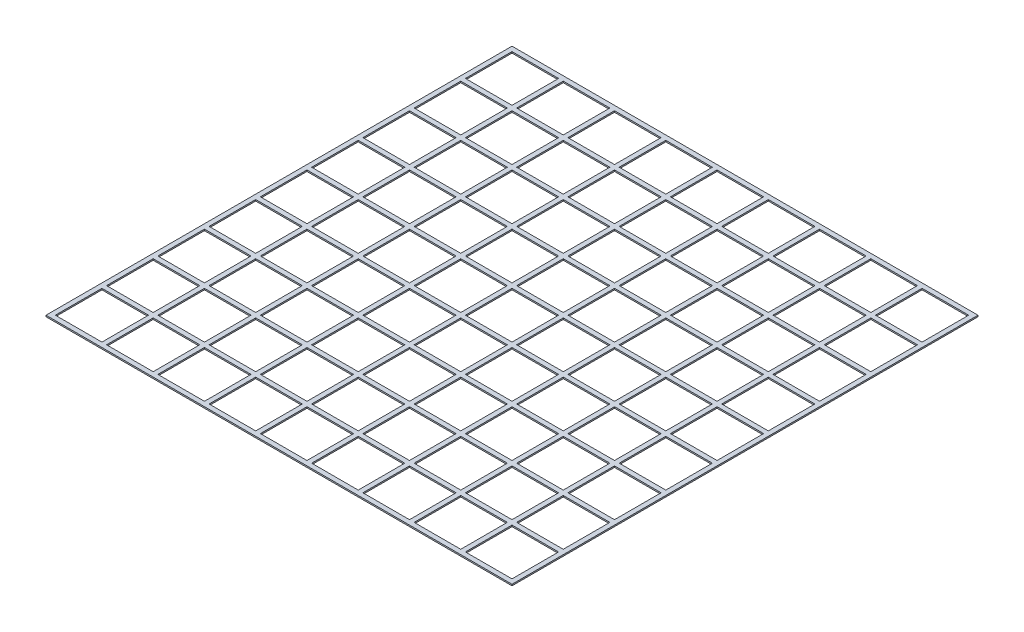
from build123d import *

# Parameters (mm, degrees)
SKETCH1_W                 = 1000
SKETCH1_H                 = 1000
BASE_FLANGE1_DEPTH        = 3
FILL_START                = -490
FILL_PATTERN1_OUTLINE_W   = 3
FILL_PATTERN1_OUTLINE_H   = 100
FILL_PATTERN1_DEPTH       = 100
FILL_START_2              = -380
FILL_PATTERN1_2_OUTLINE_W = 3
FILL_PATTERN1_2_OUTLINE_H = 100
FILL_PATTERN1_2_DEPTH     = 100
FILL_START_3              = -270
FILL_PATTERN1_3_OUTLINE_W = 3
FILL_PATTERN1_3_OUTLINE_H = 100
FILL_PATTERN1_3_DEPTH     = 100
FILL_START_4              = -160
FILL_PATTERN1_4_OUTLINE_W = 3
FILL_PATTERN1_4_OUTLINE_H = 100
FILL_PATTERN1_4_DEPTH     = 100
FILL_START_5              = -50
FILL_PATTERN1_5_OUTLINE_W = 3
FILL_PATTERN1_5_OUTLINE_H = 100
FILL_PATTERN1_5_DEPTH     = 100
FILL_START_6              = 60
FILL_PATTERN1_6_OUTLINE_W = 3
FILL_PATTERN1_6_OUTLINE_H = 100
FILL_PATTERN1_6_DEPTH     = 100
FILL_START_7              = 170
FILL_PATTERN1_7_OUTLINE_W = 3
FILL_PATTERN1_7_OUTLINE_H = 100
FILL_PATTERN1_7_DEPTH     = 100
FILL_START_8              = 280
FILL_PATTERN1_8_OUTLINE_W = 3
FILL_PATTERN1_8_OUTLINE_H = 100
FILL_PATTERN1_8_DEPTH     = 100
FILL_START_9              = 390
FILL_PATTERN1_9_OUTLINE_W = 3
FILL_PATTERN1_9_OUTLINE_H = 100
FILL_PATTERN1_9_DEPTH     = 100


# Read off the part's stored shape, not the designer's step: Fill Pattern1
# Sheet-metal steps are written as plain solids
with BuildPart() as part:
    # Sketch1 → Base-Flange1 (new body)
    with BuildSketch(Plane(origin=(0, 0, 0), x_dir=(1, 0, 0), z_dir=(0, 1, 0))):
        Rectangle(SKETCH1_W, SKETCH1_H)
    extrude(amount=-BASE_FLANGE1_DEPTH)

    # Fill Pattern1 outline → Fill Pattern1 (cut)
    with BuildSketch(Plane.YZ.offset(FILL_START)):
        with Locations((-1.5, 0)):
            Rectangle(FILL_PATTERN1_OUTLINE_W, FILL_PATTERN1_OUTLINE_H)
        with Locations((-1.5, -110)):
            Rectangle(FILL_PATTERN1_OUTLINE_W, FILL_PATTERN1_OUTLINE_H)
        with Locations((-1.5, 110)):
            Rectangle(FILL_PATTERN1_OUTLINE_W, FILL_PATTERN1_OUTLINE_H)
        with Locations((-1.5, -220)):
            Rectangle(FILL_PATTERN1_OUTLINE_W, FILL_PATTERN1_OUTLINE_H)
        with Locations((-1.5, 220)):
            Rectangle(FILL_PATTERN1_OUTLINE_W, FILL_PATTERN1_OUTLINE_H)
        with Locations((-1.5, -330)):
            Rectangle(FILL_PATTERN1_OUTLINE_W, FILL_PATTERN1_OUTLINE_H)
        with Locations((-1.5, 330)):
            Rectangle(FILL_PATTERN1_OUTLINE_W, FILL_PATTERN1_OUTLINE_H)
        with Locations((-1.5, -440)):
            Rectangle(FILL_PATTERN1_OUTLINE_W, FILL_PATTERN1_OUTLINE_H)
        with Locations((-1.5, 440)):
            Rectangle(FILL_PATTERN1_OUTLINE_W, FILL_PATTERN1_OUTLINE_H)
    extrude(amount=FILL_PATTERN1_DEPTH, mode=Mode.SUBTRACT)

    # Fill Pattern1 2 outline → Fill Pattern1 2 (cut)
    with BuildSketch(Plane.YZ.offset(FILL_START_2)):
        with Locations((-1.5, 0)):
            Rectangle(FILL_PATTERN1_2_OUTLINE_W, FILL_PATTERN1_2_OUTLINE_H)
        with Locations((-1.5, -110)):
            Rectangle(FILL_PATTERN1_2_OUTLINE_W, FILL_PATTERN1_2_OUTLINE_H)
        with Locations((-1.5, 110)):
            Rectangle(FILL_PATTERN1_2_OUTLINE_W, FILL_PATTERN1_2_OUTLINE_H)
        with Locations((-1.5, -220)):
            Rectangle(FILL_PATTERN1_2_OUTLINE_W, FILL_PATTERN1_2_OUTLINE_H)
        with Locations((-1.5, 220)):
            Rectangle(FILL_PATTERN1_2_OUTLINE_W, FILL_PATTERN1_2_OUTLINE_H)
        with Locations((-1.5, -330)):
            Rectangle(FILL_PATTERN1_2_OUTLINE_W, FILL_PATTERN1_2_OUTLINE_H)
        with Locations((-1.5, 330)):
            Rectangle(FILL_PATTERN1_2_OUTLINE_W, FILL_PATTERN1_2_OUTLINE_H)
        with Locations((-1.5, -440)):
            Rectangle(FILL_PATTERN1_2_OUTLINE_W, FILL_PATTERN1_2_OUTLINE_H)
        with Locations((-1.5, 440)):
            Rectangle(FILL_PATTERN1_2_OUTLINE_W, FILL_PATTERN1_2_OUTLINE_H)
    extrude(amount=FILL_PATTERN1_2_DEPTH, mode=Mode.SUBTRACT)

    # Fill Pattern1 3 outline → Fill Pattern1 3 (cut)
    with BuildSketch(Plane.YZ.offset(FILL_START_3)):
        with Locations((-1.5, 0)):
            Rectangle(FILL_PATTERN1_3_OUTLINE_W, FILL_PATTERN1_3_OUTLINE_H)
        with Locations((-1.5, -110)):
            Rectangle(FILL_PATTERN1_3_OUTLINE_W, FILL_PATTERN1_3_OUTLINE_H)
        with Locations((-1.5, 110)):
            Rectangle(FILL_PATTERN1_3_OUTLINE_W, FILL_PATTERN1_3_OUTLINE_H)
        with Locations((-1.5, -220)):
            Rectangle(FILL_PATTERN1_3_OUTLINE_W, FILL_PATTERN1_3_OUTLINE_H)
        with Locations((-1.5, 220)):
            Rectangle(FILL_PATTERN1_3_OUTLINE_W, FILL_PATTERN1_3_OUTLINE_H)
        with Locations((-1.5, -330)):
            Rectangle(FILL_PATTERN1_3_OUTLINE_W, FILL_PATTERN1_3_OUTLINE_H)
        with Locations((-1.5, 330)):
            Rectangle(FILL_PATTERN1_3_OUTLINE_W, FILL_PATTERN1_3_OUTLINE_H)
        with Locations((-1.5, -440)):
            Rectangle(FILL_PATTERN1_3_OUTLINE_W, FILL_PATTERN1_3_OUTLINE_H)
        with Locations((-1.5, 440)):
            Rectangle(FILL_PATTERN1_3_OUTLINE_W, FILL_PATTERN1_3_OUTLINE_H)
    extrude(amount=FILL_PATTERN1_3_DEPTH, mode=Mode.SUBTRACT)

    # Fill Pattern1 4 outline → Fill Pattern1 4 (cut)
    with BuildSketch(Plane.YZ.offset(FILL_START_4)):
        with Locations((-1.5, 0)):
            Rectangle(FILL_PATTERN1_4_OUTLINE_W, FILL_PATTERN1_4_OUTLINE_H)
        with Locations((-1.5, -110)):
            Rectangle(FILL_PATTERN1_4_OUTLINE_W, FILL_PATTERN1_4_OUTLINE_H)
        with Locations((-1.5, 110)):
            Rectangle(FILL_PATTERN1_4_OUTLINE_W, FILL_PATTERN1_4_OUTLINE_H)
        with Locations((-1.5, -220)):
            Rectangle(FILL_PATTERN1_4_OUTLINE_W, FILL_PATTERN1_4_OUTLINE_H)
        with Locations((-1.5, 220)):
            Rectangle(FILL_PATTERN1_4_OUTLINE_W, FILL_PATTERN1_4_OUTLINE_H)
        with Locations((-1.5, -330)):
            Rectangle(FILL_PATTERN1_4_OUTLINE_W, FILL_PATTERN1_4_OUTLINE_H)
        with Locations((-1.5, 330)):
            Rectangle(FILL_PATTERN1_4_OUTLINE_W, FILL_PATTERN1_4_OUTLINE_H)
        with Locations((-1.5, -440)):
            Rectangle(FILL_PATTERN1_4_OUTLINE_W, FILL_PATTERN1_4_OUTLINE_H)
        with Locations((-1.5, 440)):
            Rectangle(FILL_PATTERN1_4_OUTLINE_W, FILL_PATTERN1_4_OUTLINE_H)
    extrude(amount=FILL_PATTERN1_4_DEPTH, mode=Mode.SUBTRACT)

    # Fill Pattern1 5 outline → Fill Pattern1 5 (cut)
    with BuildSketch(Plane.YZ.offset(FILL_START_5)):
        with Locations((-1.5, 0)):
            Rectangle(FILL_PATTERN1_5_OUTLINE_W, FILL_PATTERN1_5_OUTLINE_H)
        with Locations((-1.5, -110)):
            Rectangle(FILL_PATTERN1_5_OUTLINE_W, FILL_PATTERN1_5_OUTLINE_H)
        with Locations((-1.5, 110)):
            Rectangle(FILL_PATTERN1_5_OUTLINE_W, FILL_PATTERN1_5_OUTLINE_H)
        with Locations((-1.5, -220)):
            Rectangle(FILL_PATTERN1_5_OUTLINE_W, FILL_PATTERN1_5_OUTLINE_H)
        with Locations((-1.5, 220)):
            Rectangle(FILL_PATTERN1_5_OUTLINE_W, FILL_PATTERN1_5_OUTLINE_H)
        with Locations((-1.5, -330)):
            Rectangle(FILL_PATTERN1_5_OUTLINE_W, FILL_PATTERN1_5_OUTLINE_H)
        with Locations((-1.5, 330)):
            Rectangle(FILL_PATTERN1_5_OUTLINE_W, FILL_PATTERN1_5_OUTLINE_H)
        with Locations((-1.5, -440)):
            Rectangle(FILL_PATTERN1_5_OUTLINE_W, FILL_PATTERN1_5_OUTLINE_H)
        with Locations((-1.5, 440)):
            Rectangle(FILL_PATTERN1_5_OUTLINE_W, FILL_PATTERN1_5_OUTLINE_H)
    extrude(amount=FILL_PATTERN1_5_DEPTH, mode=Mode.SUBTRACT)

    # Fill Pattern1 6 outline → Fill Pattern1 6 (cut)
    with BuildSketch(Plane.YZ.offset(FILL_START_6)):
        with Locations((-1.5, 0)):
            Rectangle(FILL_PATTERN1_6_OUTLINE_W, FILL_PATTERN1_6_OUTLINE_H)
        with Locations((-1.5, -110)):
            Rectangle(FILL_PATTERN1_6_OUTLINE_W, FILL_PATTERN1_6_OUTLINE_H)
        with Locations((-1.5, 110)):
            Rectangle(FILL_PATTERN1_6_OUTLINE_W, FILL_PATTERN1_6_OUTLINE_H)
        with Locations((-1.5, -220)):
            Rectangle(FILL_PATTERN1_6_OUTLINE_W, FILL_PATTERN1_6_OUTLINE_H)
        with Locations((-1.5, 220)):
            Rectangle(FILL_PATTERN1_6_OUTLINE_W, FILL_PATTERN1_6_OUTLINE_H)
        with Locations((-1.5, -330)):
            Rectangle(FILL_PATTERN1_6_OUTLINE_W, FILL_PATTERN1_6_OUTLINE_H)
        with Locations((-1.5, 330)):
            Rectangle(FILL_PATTERN1_6_OUTLINE_W, FILL_PATTERN1_6_OUTLINE_H)
        with Locations((-1.5, -440)):
            Rectangle(FILL_PATTERN1_6_OUTLINE_W, FILL_PATTERN1_6_OUTLINE_H)
        with Locations((-1.5, 440)):
            Rectangle(FILL_PATTERN1_6_OUTLINE_W, FILL_PATTERN1_6_OUTLINE_H)
    extrude(amount=FILL_PATTERN1_6_DEPTH, mode=Mode.SUBTRACT)

    # Fill Pattern1 7 outline → Fill Pattern1 7 (cut)
    with BuildSketch(Plane.YZ.offset(FILL_START_7)):
        with Locations((-1.5, 0)):
            Rectangle(FILL_PATTERN1_7_OUTLINE_W, FILL_PATTERN1_7_OUTLINE_H)
        with Locations((-1.5, -110)):
            Rectangle(FILL_PATTERN1_7_OUTLINE_W, FILL_PATTERN1_7_OUTLINE_H)
        with Locations((-1.5, 110)):
            Rectangle(FILL_PATTERN1_7_OUTLINE_W, FILL_PATTERN1_7_OUTLINE_H)
        with Locations((-1.5, -220)):
            Rectangle(FILL_PATTERN1_7_OUTLINE_W, FILL_PATTERN1_7_OUTLINE_H)
        with Locations((-1.5, 220)):
            Rectangle(FILL_PATTERN1_7_OUTLINE_W, FILL_PATTERN1_7_OUTLINE_H)
        with Locations((-1.5, -330)):
            Rectangle(FILL_PATTERN1_7_OUTLINE_W, FILL_PATTERN1_7_OUTLINE_H)
        with Locations((-1.5, 330)):
            Rectangle(FILL_PATTERN1_7_OUTLINE_W, FILL_PATTERN1_7_OUTLINE_H)
        with Locations((-1.5, -440)):
            Rectangle(FILL_PATTERN1_7_OUTLINE_W, FILL_PATTERN1_7_OUTLINE_H)
        with Locations((-1.5, 440)):
            Rectangle(FILL_PATTERN1_7_OUTLINE_W, FILL_PATTERN1_7_OUTLINE_H)
    extrude(amount=FILL_PATTERN1_7_DEPTH, mode=Mode.SUBTRACT)

    # Fill Pattern1 8 outline → Fill Pattern1 8 (cut)
    with BuildSketch(Plane.YZ.offset(FILL_START_8)):
        with Locations((-1.5, 0)):
            Rectangle(FILL_PATTERN1_8_OUTLINE_W, FILL_PATTERN1_8_OUTLINE_H)
        with Locations((-1.5, -110)):
            Rectangle(FILL_PATTERN1_8_OUTLINE_W, FILL_PATTERN1_8_OUTLINE_H)
        with Locations((-1.5, 110)):
            Rectangle(FILL_PATTERN1_8_OUTLINE_W, FILL_PATTERN1_8_OUTLINE_H)
        with Locations((-1.5, -220)):
            Rectangle(FILL_PATTERN1_8_OUTLINE_W, FILL_PATTERN1_8_OUTLINE_H)
        with Locations((-1.5, 220)):
            Rectangle(FILL_PATTERN1_8_OUTLINE_W, FILL_PATTERN1_8_OUTLINE_H)
        with Locations((-1.5, -330)):
            Rectangle(FILL_PATTERN1_8_OUTLINE_W, FILL_PATTERN1_8_OUTLINE_H)
        with Locations((-1.5, 330)):
            Rectangle(FILL_PATTERN1_8_OUTLINE_W, FILL_PATTERN1_8_OUTLINE_H)
        with Locations((-1.5, -440)):
            Rectangle(FILL_PATTERN1_8_OUTLINE_W, FILL_PATTERN1_8_OUTLINE_H)
        with Locations((-1.5, 440)):
            Rectangle(FILL_PATTERN1_8_OUTLINE_W, FILL_PATTERN1_8_OUTLINE_H)
    extrude(amount=FILL_PATTERN1_8_DEPTH, mode=Mode.SUBTRACT)

    # Fill Pattern1 9 outline → Fill Pattern1 9 (cut)
    with BuildSketch(Plane.YZ.offset(FILL_START_9)):
        with Locations((-1.5, 0)):
            Rectangle(FILL_PATTERN1_9_OUTLINE_W, FILL_PATTERN1_9_OUTLINE_H)
        with Locations((-1.5, -110)):
            Rectangle(FILL_PATTERN1_9_OUTLINE_W, FILL_PATTERN1_9_OUTLINE_H)
        with Locations((-1.5, 110)):
            Rectangle(FILL_PATTERN1_9_OUTLINE_W, FILL_PATTERN1_9_OUTLINE_H)
        with Locations((-1.5, -220)):
            Rectangle(FILL_PATTERN1_9_OUTLINE_W, FILL_PATTERN1_9_OUTLINE_H)
        with Locations((-1.5, 220)):
            Rectangle(FILL_PATTERN1_9_OUTLINE_W, FILL_PATTERN1_9_OUTLINE_H)
        with Locations((-1.5, -330)):
            Rectangle(FILL_PATTERN1_9_OUTLINE_W, FILL_PATTERN1_9_OUTLINE_H)
        with Locations((-1.5, 330)):
            Rectangle(FILL_PATTERN1_9_OUTLINE_W, FILL_PATTERN1_9_OUTLINE_H)
        with Locations((-1.5, -440)):
            Rectangle(FILL_PATTERN1_9_OUTLINE_W, FILL_PATTERN1_9_OUTLINE_H)
        with Locations((-1.5, 440)):
            Rectangle(FILL_PATTERN1_9_OUTLINE_W, FILL_PATTERN1_9_OUTLINE_H)
    extrude(amount=FILL_PATTERN1_9_DEPTH, mode=Mode.SUBTRACT)


solid = part.part
